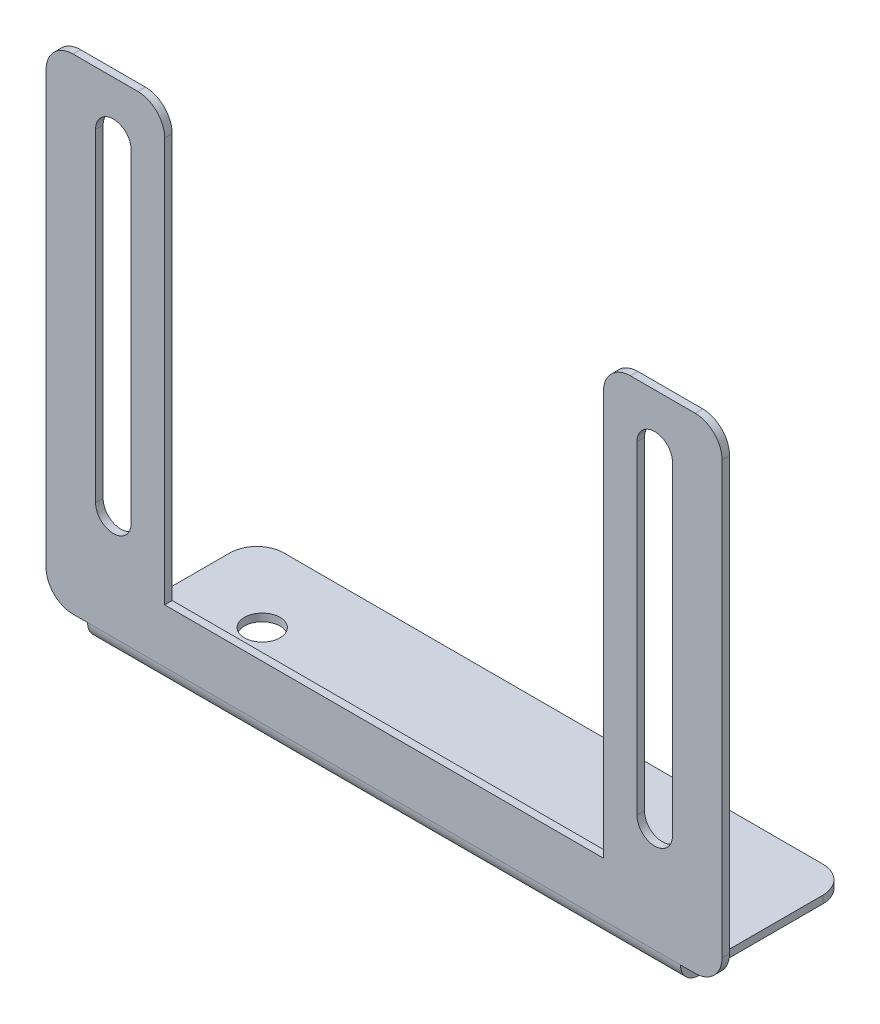
from build123d import *

# Parameters (mm, degrees)
BASE_FLANGE1_DEPTH    = 0.7
EDGE_FLANGE1_DEPTH    = 55
CUT_EXTRUDE1_DEPTH    = 10
CUT_EXTRUDE2_REACH    = 59.839
SKETCH9_R             = 1.65
BREAK_CORNER1_START   = -24.2
BREAK_CORNER1_DEPTH   = 0.7
BREAK_CORNER1_START_2 = -0.7
BREAK_CORNER1_2_DEPTH = 0.7


# Read off the part's stored shape, not the designer's step: Break-Corner1
# Sheet-metal steps are written as plain solids
with BuildPart() as part:
    # Sketch2 → Base-Flange1 (new body)
    with BuildSketch(Plane.XY):
        Polygon((20.35, 22.5), (31.35, 22.5), (31.35, -22.5), (-31.35, -22.5), (-31.35, 22.5), (-20.35, 22.5), (-20.35, -17.5), (20.35, -17.5), align=None)
    extrude(amount=-BASE_FLANGE1_DEPTH)

    # Edge-Flange1 section (across the edge) → Edge-Flange1 (add)
    with BuildSketch(Plane(origin=(27.5, -23.5, -0.7), x_dir=(0, 1, 0), z_dir=(-1, 0, 0))):
        with BuildLine():
            Line((-0.7, 1), (-0.7, 15))
            Line((-0.7, 15), (0, 15))
            Line((0, 15), (0, 1))
            ThreePointArc((0, 1), (0.292893219, 0.292893219), (1, 0))
            Line((1, 0), (1, -0.7))
            ThreePointArc((1, -0.7), (-0.202081528, -0.202081528), (-0.7, 1))
        make_face()
    extrude(amount=EDGE_FLANGE1_DEPTH)

    # Sketch8 → Cut-Extrude1 (cut)
    with BuildSketch(Plane.XY):
        with BuildLine():
            Line((-23.458, 17.5), (-23.458, -12.5))
            ThreePointArc((-23.458, -12.5), (-25.108, -14.15), (-26.758, -12.5))
            Line((-26.758, -12.5), (-26.758, 17.5))
            ThreePointArc((-26.758, 17.5), (-25.108, 19.15), (-23.458, 17.5))
        make_face()
        with BuildLine():
            Line((23.458, 17.5), (23.458, -12.5))
            ThreePointArc((23.458, -12.5), (25.108, -14.15), (26.758, -12.5))
            Line((26.758, -12.5), (26.758, 17.5))
            ThreePointArc((26.758, 17.5), (25.108, 19.15), (23.458, 17.5))
        make_face()
    extrude(amount=-CUT_EXTRUDE1_DEPTH, mode=Mode.SUBTRACT)

    # Sketch9 → Cut-Extrude2 (cut, up to next)
    with BuildSketch(Plane(origin=(0, -23.5, 0), x_dir=(1, 0, 0), z_dir=(0, 1, 0)), mode=Mode.PRIVATE) as cut_extrude2_sk1:
        with Locations(Location((-20, 8.7, 0), (0, 0, 270))):
            Circle(SKETCH9_R)
    cut_extrude2_tool1 = extrude(cut_extrude2_sk1.sketch, amount=-CUT_EXTRUDE2_REACH, mode=Mode.PRIVATE) & part.part
    # Sketch9 → Cut-Extrude2 (cut, up to next)
    with BuildSketch(Plane(origin=(0, -23.5, 0), x_dir=(1, 0, 0), z_dir=(0, 1, 0)), mode=Mode.PRIVATE) as cut_extrude2_sk2:
        with Locations(Location((20, 8.7, 0), (0, 0, 90))):
            Circle(SKETCH9_R)
    cut_extrude2_tool2 = extrude(cut_extrude2_sk2.sketch, amount=-CUT_EXTRUDE2_REACH, mode=Mode.PRIVATE) & part.part
    add(cut_extrude2_tool1.solids().sort_by_distance((-20, -23.5, -8.7))[0], mode=Mode.SUBTRACT)
    add(cut_extrude2_tool2.solids().sort_by_distance((20, -23.5, -8.7))[0], mode=Mode.SUBTRACT)

    # Break-Corner1 outline → Break-Corner1 (cut)
    with BuildSketch(Plane(origin=(0, 0, 0), x_dir=(1, 0, 0), z_dir=(0, 1, 0)).offset(BREAK_CORNER1_START)):
        with BuildLine():
            Line((27.5, 15.7), (25, 15.7))
            ThreePointArc((25, 15.7), (26.767766953, 14.967766953), (27.5, 13.2))
            Line((27.5, 13.2), (27.5, 15.7))
        make_face()
        with BuildLine():
            ThreePointArc((-27.5, 13.2), (-26.767766953, 14.967766953), (-25, 15.7))
            Line((-25, 15.7), (-27.5, 15.7))
            Line((-27.5, 15.7), (-27.5, 13.2))
        make_face()
    extrude(amount=BREAK_CORNER1_DEPTH, mode=Mode.SUBTRACT)

    # Break-Corner1 2 outline → Break-Corner1 2 (cut)
    with BuildSketch(Plane.XY.offset(BREAK_CORNER1_START_2)):
        with BuildLine():
            ThreePointArc((20.35, 20), (21.082233047, 21.767766953), (22.85, 22.5))
            Line((22.85, 22.5), (20.35, 22.5))
            Line((20.35, 22.5), (20.35, 20))
        make_face()
        with BuildLine():
            ThreePointArc((28.85, 22.5), (30.617766953, 21.767766953), (31.35, 20))
            Line((31.35, 20), (31.35, 22.5))
            Line((31.35, 22.5), (28.85, 22.5))
        make_face()
        with BuildLine():
            ThreePointArc((31.35, -20), (30.617766953, -21.767766953), (28.85, -22.5))
            Line((28.85, -22.5), (31.35, -22.5))
            Line((31.35, -22.5), (31.35, -20))
        make_face()
        with BuildLine():
            Line((-20.35, 22.5), (-22.85, 22.5))
            ThreePointArc((-22.85, 22.5), (-21.082233047, 21.767766953), (-20.35, 20))
            Line((-20.35, 20), (-20.35, 22.5))
        make_face()
        with BuildLine():
            Line((-31.35, 22.5), (-31.35, 20))
            ThreePointArc((-31.35, 20), (-30.617766953, 21.767766953), (-28.85, 22.5))
            Line((-28.85, 22.5), (-31.35, 22.5))
        make_face()
        with BuildLine():
            ThreePointArc((-28.85, -22.5), (-30.617766953, -21.767766953), (-31.35, -20))
            Line((-31.35, -20), (-31.35, -22.5))
            Line((-31.35, -22.5), (-28.85, -22.5))
        make_face()
    extrude(amount=BREAK_CORNER1_2_DEPTH, mode=Mode.SUBTRACT)


solid = part.part
